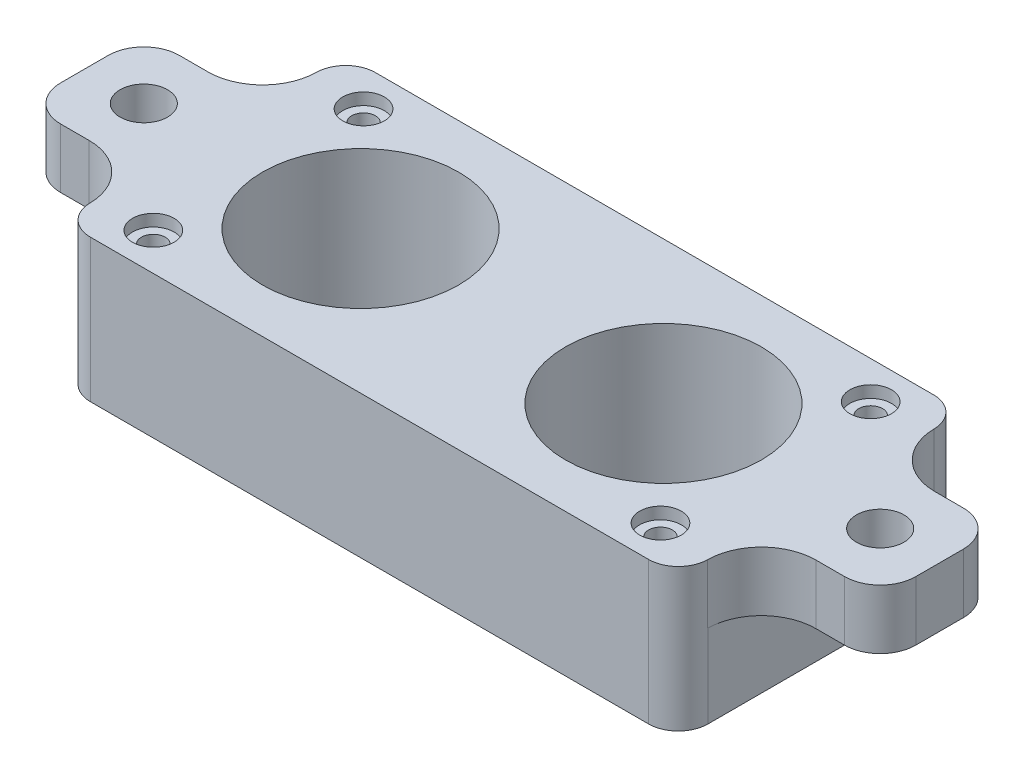
from build123d import *

# Parameters (mm, degrees)
SKETCH1_W           = 52
SKETCH1_H           = 24
SKETCH1_R           = 8.25
BOSS_EXTRUDE1_DEPTH = 12
SKETCH2_R           = 1
CUT_EXTRUDE1_DEPTH  = 32.048349393
SKETCH3_R           = 1.75
CUT_EXTRUDE2_DEPTH  = 1
FILLET1_R           = 2.5
CUT_EXTRUDE3_DEPTH  = 5
FILLET2_R           = 0.5
SKETCH6_W           = 10
SKETCH6_H           = 10
SKETCH6_R           = 2
BOSS_EXTRUDE2_DEPTH = 5
FILLET3_R           = 4.6
FILLET4_R           = 3


with BuildPart() as part:
    # Sketch1 → Boss-Extrude1 (new body)
    with BuildSketch(Plane(origin=(0, 0, 0), x_dir=(1, 0, 0), z_dir=(0, 1, 0))):
        Rectangle(SKETCH1_W, SKETCH1_H)
        with Locations(Location((12.75, 0, 0), (0, 0, 270))):
            Circle(SKETCH1_R, mode=Mode.SUBTRACT)
        with Locations(Location((-12.75, 0, 0), (0, 0, 270))):
            Circle(SKETCH1_R, mode=Mode.SUBTRACT)
    extrude(amount=BOSS_EXTRUDE1_DEPTH)

    # Sketch2 → Cut-Extrude1 (cut, through all)
    with BuildSketch(Plane(origin=(0, 12, 0), x_dir=(1, 0, 0), z_dir=(0, 1, 0))):
        with Locations(Location((-21.35, 8.85, 0), (0, 0, 270))):
            Circle(SKETCH2_R)
        with Locations(Location((21.35, 8.85, 0), (0, 0, 270))):
            Circle(SKETCH2_R)
        with Locations(Location((21.35, -8.85, 0), (0, 0, 270))):
            Circle(SKETCH2_R)
        with Locations(Location((-21.35, -8.85, 0), (0, 0, 270))):
            Circle(SKETCH2_R)
    extrude(amount=-CUT_EXTRUDE1_DEPTH, mode=Mode.SUBTRACT)

    # Sketch3 → Cut-Extrude2 (cut)
    with BuildSketch(Plane(origin=(0, 12, 0), x_dir=(1, 0, 0), z_dir=(0, 1, 0))):
        with Locations(Location((-21.35, 8.85, 0), (0, 0, 270))):
            Circle(SKETCH3_R)
        with Locations(Location((21.35, 8.85, 0), (0, 0, 270))):
            Circle(SKETCH3_R)
        with Locations(Location((21.35, -8.85, 0), (0, 0, 270))):
            Circle(SKETCH3_R)
        with Locations(Location((-21.35, -8.85, 0), (0, 0, 270))):
            Circle(SKETCH3_R)
    extrude(amount=-CUT_EXTRUDE2_DEPTH, mode=Mode.SUBTRACT)

    # Fillet1
    fillet1_edges = [part.edges().sort_by_distance(p)[0] for p in [
        (26, 6, 12),
        (-26, 6, 12),
        (-26, 6, -12),
        (26, 6, -12),
    ]]
    fillet(fillet1_edges, radius=FILLET1_R)

    # Sketch4 → Cut-Extrude3 (cut)
    with BuildSketch(Plane.XZ):
        Polygon((-6, -5), (-6, -12), (6, -12), (6, -5), (0, -5), align=None)
    extrude(amount=-CUT_EXTRUDE3_DEPTH, mode=Mode.SUBTRACT)

    # Fillet2
    fillet2_edges = [part.edges().sort_by_distance(p)[0] for p in [
        (0, 5, -12),
        (6, 2.5, -12),
        (-6, 2.5, -12),
        (-6, 2.5, -5),
        (6, 5, -8.5),
        (6, 2.5, -5),
        (-6, 5, -8.5),
        (0, 5, -5),
    ]]
    fillet(fillet2_edges, radius=FILLET2_R)

    # Sketch6 → Boss-Extrude2 (add)
    # profile 1 of 2: a face of its own
    with BuildSketch(Plane(origin=(0, 12, 0), x_dir=(1, 0, 0), z_dir=(0, 1, 0))):
        with Locations((-31, 0)):
            Rectangle(SKETCH6_W, SKETCH6_H)
        with Locations(Location((-31, 0, 0), (0, 0, 270))):
            Circle(SKETCH6_R, mode=Mode.SUBTRACT)
    # profile 2 of 2: a face of its own
    with BuildSketch(Plane(origin=(0, 12, 0), x_dir=(1, 0, 0), z_dir=(0, 1, 0))):
        with Locations((31, 0)):
            Rectangle(SKETCH6_W, SKETCH6_H)
        with Locations(Location((31, 0, 0), (0, 0, 90))):
            Circle(SKETCH6_R, mode=Mode.SUBTRACT)
    extrude(amount=-BOSS_EXTRUDE2_DEPTH)

    # Fillet3
    # the kernel refuses this fillet: 4.6 mm, written as the material it adds along each edge
    with BuildSketch(Plane(origin=(26, 12, 5), x_dir=(-5.467859312132584e-05, 0, 0.9999999985051258), z_dir=(0, -1, 0)), Plane(origin=(-26, 12, -5), x_dir=(5.467859312132586e-05, 0, -0.9999999985051258), z_dir=(0, -1, 0))) as fillet3_piece_1:
        with BuildLine():
            CenterArc((4.59974851, -4.599547254), FILLET3_R, 90.80387664, 89.192990507)
            Line((-0.000251483, -4.599295733), (-0.460251482, -4.599270581))
            Line((-0.460251482, -4.599270581), (-0.459999999, 2.5152e-05))
            Line((-0.459999999, 2.5152e-05), (2.5152e-05, 0.459999999))
            ThreePointArc((2.5152e-05, 0.459999999), (4.500025145, 0.459753946), (4.528757551, 0.459954725))
            Line((4.528757551, 0.459954725), (4.535211274, 0))
        make_face()
    extrude(amount=5)
    with BuildSketch(Plane(origin=(-26, 12, 5), x_dir=(5.467859312289258e-05, 0, 0.9999999985051258), z_dir=(0, -1, 0)), Plane(origin=(26, 12, -5), x_dir=(-5.467859312132581e-05, 0, -0.9999999985051258), z_dir=(0, -1, 0))) as fillet3_piece_2:
        with BuildLine():
            CenterArc((4.59974851, 4.599547254), FILLET3_R, 180.003132853, 89.192990507)
            Line((-0.000251483, 4.599295733), (-0.460251482, 4.599270581))
            Line((-0.460251482, 4.599270581), (-0.459999999, -2.5152e-05))
            Line((-0.459999999, -2.5152e-05), (2.5152e-05, -0.459999999))
            ThreePointArc((2.5152e-05, -0.459999999), (4.500025145, -0.459753946), (4.528757551, -0.459954725))
            Line((4.528757551, -0.459954725), (4.535211274, 0))
        make_face()
    extrude(amount=5)

    # Fillet4
    fillet4_edges = [part.edges().sort_by_distance(p)[0] for p in [
        (-36, 9.5, 5),
        (-36, 9.5, -5),
        (36, 9.5, -5),
        (36, 9.5, 5),
    ]]
    fillet(fillet4_edges, radius=FILLET4_R)


solid = part.part
